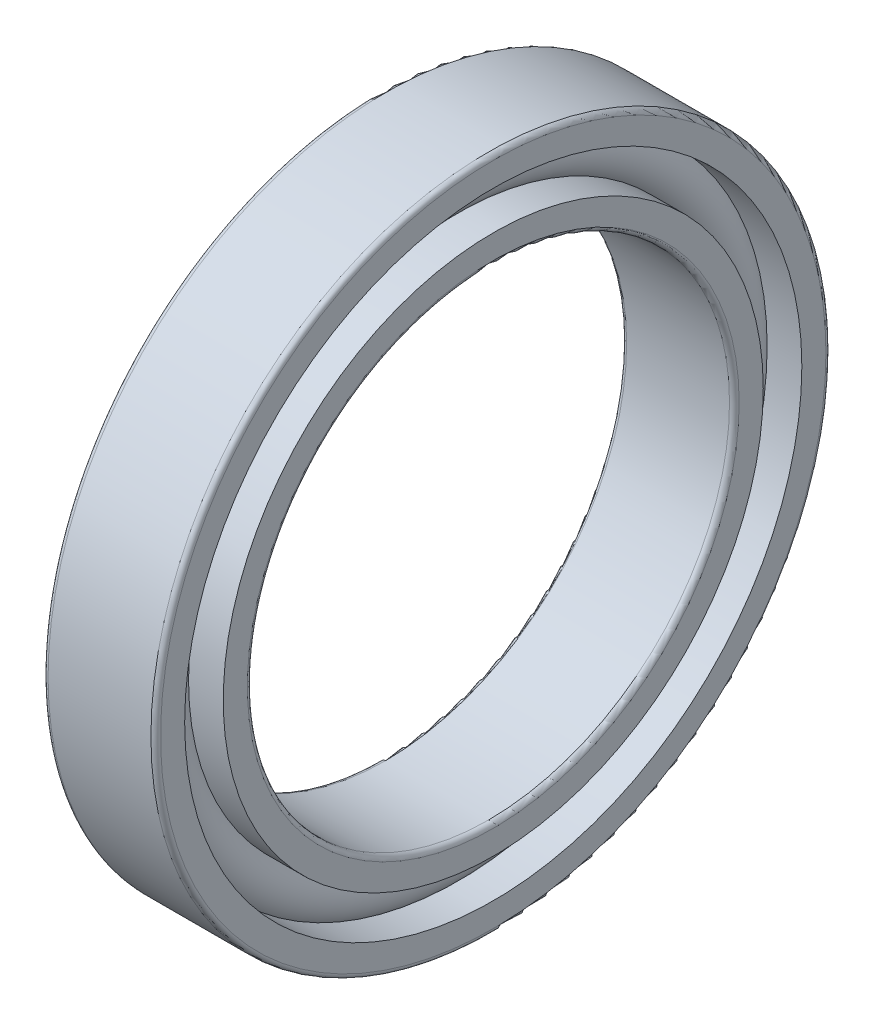
from build123d import *

# Parameters (mm, degrees)
CAGSPISKE_W     = 0.36
CAGSPISKE_H     = 0.6
CAGESPINE_ANGLE = 0.001
BALSIMSKE_R     = 1.8


with BuildPart() as part:
    # CagSpiSke → CageSpine (revolve)
    with BuildSketch(Plane.XY):
        with Locations((0, 18)):
            Rectangle(CAGSPISKE_W, CAGSPISKE_H)
    revolve(axis=Axis((-20.6375, 0, 0), (-1, 0, 0)), revolution_arc=CAGESPINE_ANGLE)

    # BalSimSke → BallsSimplified (revolve)
    with BuildSketch(Plane.XY):
        with Locations((0, 18)):
            Circle(BALSIMSKE_R)
    revolve(axis=Axis((-10, 0, 0), (1, 0, 0)))

    # InnRacSke → InnerRace (revolve)
    with BuildSketch(Plane.XY):
        with BuildLine():
            Line((-1.307908636, 16.8), (-3.5, 16.8))
            Line((-3.5, 16.8), (-3.5, 15.3))
            ThreePointArc((-3.5, 15.3), (-3.412132034, 15.087867966), (-3.2, 15))
            Line((-3.2, 15), (3.2, 15))
            ThreePointArc((3.2, 15), (3.412132034, 15.087867966), (3.5, 15.3))
            Line((3.5, 15.3), (3.5, 16.8))
            Line((3.5, 16.8), (1.307908636, 16.8))
            ThreePointArc((1.307908636, 16.8), (0, 16.225), (-1.307908636, 16.8))
        make_face()
    revolve(axis=Axis((-20.6375, 0, 0), (1, 0, 0)))

    # OutRacSke → OuterRace (revolve)
    with BuildSketch(Plane.XY):
        with BuildLine():
            Line((-1.307908636, 19.2), (-3.5, 19.2))
            Line((-3.5, 19.2), (-3.5, 20.7))
            ThreePointArc((-3.5, 20.7), (-3.412132034, 20.912132034), (-3.2, 21))
            Line((-3.2, 21), (3.2, 21))
            ThreePointArc((3.2, 21), (3.412132034, 20.912132034), (3.5, 20.7))
            Line((3.5, 20.7), (3.5, 19.2))
            Line((3.5, 19.2), (1.307908636, 19.2))
            ThreePointArc((1.307908636, 19.2), (0, 19.775), (-1.307908636, 19.2))
        make_face()
    revolve(axis=Axis((-20.6375, 0, 0), (1, 0, 0)))


solid = part.part
